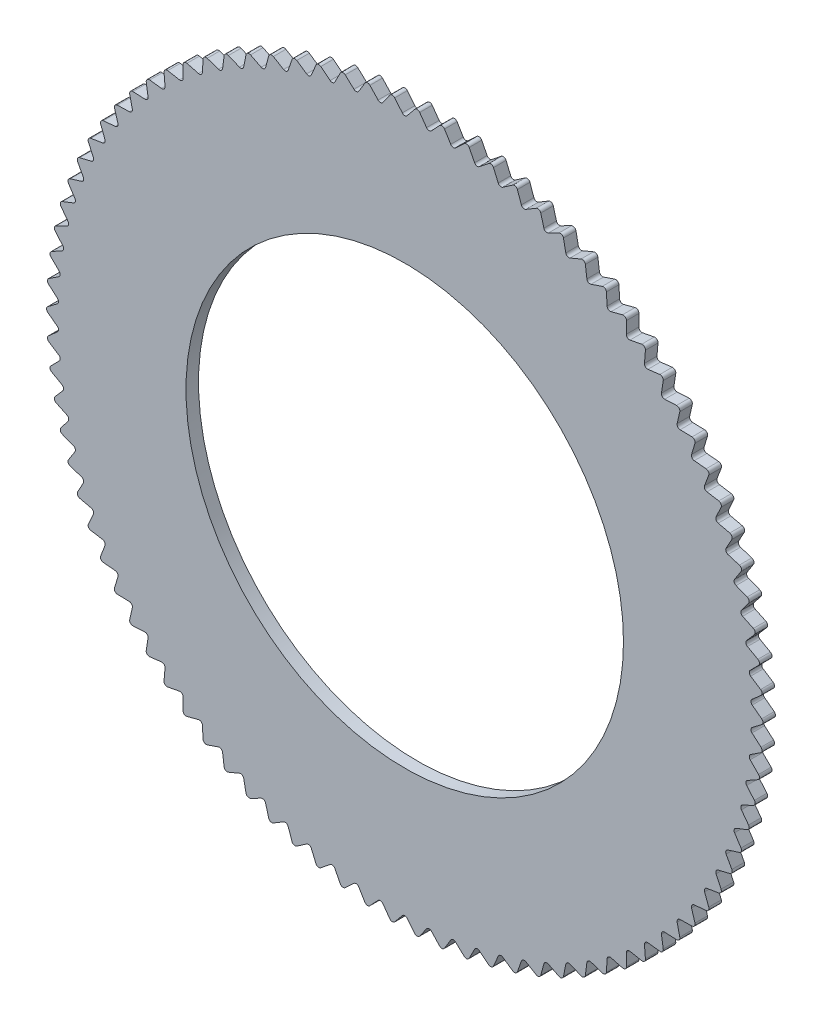
from build123d import *

# Parameters (mm, degrees)
SKETCH2_R           = 228.75
BOSS_EXTRUDE1_DEPTH = 8
CUT_EXTRUDE3_START  = -20
CUT_EXTRUDE3_DEPTH  = 20
CIRPATTERN1_COUNT   = 90
SKETCH5_R           = 139.7
CUT_EXTRUDE4_DEPTH  = 324.502626909


with BuildPart() as part:
    # Sketch2 → Boss-Extrude1 (new body)
    with BuildSketch(Plane.XY):
        Circle(SKETCH2_R)
    extrude(amount=BOSS_EXTRUDE1_DEPTH)

    # Sketch4 → Cut-Extrude3 (cut)
    with BuildSketch(Plane.XY.offset(8).offset(CUT_EXTRUDE3_START)):
        with BuildLine():
            ThreePointArc((-1.548610222, 221.984375103), (0, 221.25), (1.548610222, 221.984375103))
            Line((1.548610222, 221.984375103), (6.364850655, 227.877494924))
            ThreePointArc((6.364850655, 227.877494924), (7.088172825, 228.433654764), (7.983259871, 228.610651681))
            ThreePointArc((7.983259871, 228.610651681), (0, 228.75), (-7.983259871, 228.610651681))
            ThreePointArc((-7.983259871, 228.610651681), (-7.088172825, 228.433654764), (-6.364850655, 227.877494924))
            Line((-6.364850655, 227.877494924), (-1.548610222, 221.984375103))
        make_face()
    cut_extrude3 = extrude(amount=CUT_EXTRUDE3_DEPTH, mode=Mode.SUBTRACT)

    # CirPattern1: Cut-Extrude3 ×90 about axis
    cirpattern1_axis = Axis((0, 0, 0), (0, 0, 1))
    for i in range(1, CIRPATTERN1_COUNT):
        add(cut_extrude3.rotate(cirpattern1_axis, i * 360 / CIRPATTERN1_COUNT), mode=Mode.SUBTRACT)

    # Sketch5 → Cut-Extrude4 (cut, through all)
    with BuildSketch(Plane.XY.offset(8)):
        Circle(SKETCH5_R)
    extrude(amount=-CUT_EXTRUDE4_DEPTH, mode=Mode.SUBTRACT)


solid = part.part
